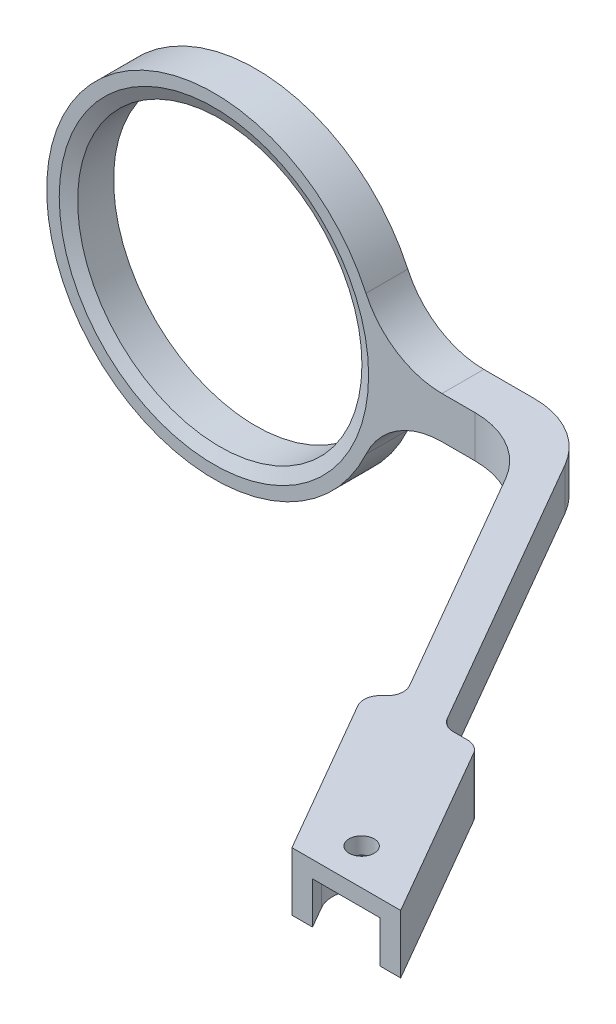
from build123d import *

# Parameters (mm, degrees)
BOSS_EXTRUDE1_DEPTH = 5
CHAMFER2_SIZE       = 1.5
CHAMFER2_SIZE2      = 0.699461487
FILLET1_R           = 10
BOSS_EXTRUDE2_DEPTH = 5
BOSS_EXTRUDE3_DEPTH = 7
CUT_EXTRUDE1_DEPTH  = 5
CUT_EXTRUDE2_DEPTH  = 1.5
SKETCH11_R          = 1.5
CUT_EXTRUDE3_DEPTH  = 102.79927269
FILLET2_R           = 10
FILLET3_R           = 2
FILLET4_R           = 2


with BuildPart() as part:
    # Sketch1 → Boss-Extrude1 (new body)
    with BuildSketch(Plane.XY):
        with BuildLine():
            ThreePointArc((16.815171721, -2.5), (-17, 0), (16.815171721, 2.5))
            Line((16.815171721, 2.5), (19.843134833, 2.5))
            ThreePointArc((19.843134833, 2.5), (-20, 0), (19.843134833, -2.5))
            Line((19.843134833, -2.5), (16.815171721, -2.5))
        make_face()
        with BuildLine():
            Line((19.843134833, 2.5), (16.815171721, 2.5))
            ThreePointArc((16.815171721, 2.5), (16.953729962, 1.253411494), (17, 0))
            ThreePointArc((17, 0), (16.953729962, -1.253411494), (16.815171721, -2.5))
            Line((16.815171721, -2.5), (19.843134833, -2.5))
            ThreePointArc((19.843134833, -2.5), (19.960745185, -1.252458251), (20, 0))
            ThreePointArc((20, 0), (19.960745185, 1.252458251), (19.843134833, 2.5))
        make_face()
        with BuildLine():
            Line((37, 2.5), (19.843134833, 2.5))
            ThreePointArc((19.843134833, 2.5), (19.960745185, 1.252458251), (20, 0))
            ThreePointArc((20, 0), (19.960745185, -1.252458251), (19.843134833, -2.5))
            Line((19.843134833, -2.5), (37, -2.5))
            Line((37, -2.5), (37, 2.5))
        make_face()
    extrude(amount=BOSS_EXTRUDE1_DEPTH)

    # Chamfer2
    chamfer2_edges = [part.edges().sort_by_distance(p)[0] for p in [
        (-16.815171721, -2.5, 5),
    ]]
    chamfer2_side = [part.faces().sort_by_distance(p)[0] for p in [
        (-17.503948469, -2.602404061, 5),
    ]]
    chamfer(chamfer2_edges, length=CHAMFER2_SIZE, length2=CHAMFER2_SIZE2, reference=chamfer2_side[0])

    # Fillet1
    fillet1_edges = [part.edges().sort_by_distance(p)[0] for p in [
        (19.843134833, 2.5, 2.5),
        (19.843134833, -2.5, 2.5),
    ]]
    fillet(fillet1_edges, radius=FILLET1_R)

    # Sketch3 → Boss-Extrude2 (add)
    with BuildSketch(Plane(origin=(0, 2.5, 0), x_dir=(1, 0, 0), z_dir=(0, 1, 0))):
        Polygon((39.113248654, 0), (74.331615075, -61), (69.331615075, -61), (37, -5), (37, 0), align=None)
    extrude(amount=-BOSS_EXTRUDE2_DEPTH)

    # Sketch5 → Boss-Extrude3 (add)
    with BuildSketch(Plane(origin=(0, 2.5, 0), x_dir=(1, 0, 0), z_dir=(0, 1, 0))):
        Polygon((65.331615075, -61), (78.331615075, -61), (65.831615075, -39.349364905), (52.831615075, -39.349364905), align=None)
    extrude(amount=-BOSS_EXTRUDE3_DEPTH)

    # Sketch9 → Cut-Extrude1 (cut)
    with BuildSketch(Plane.XZ.offset(4.5)):
        with BuildLine():
            Line((75.873066959, 61), (67.79016319, 61))
            Line((67.79016319, 61), (66.300526161, 58.419872981))
            ThreePointArc((66.300526161, 58.419872981), (67.581615075, 53.638784068), (72.362703988, 54.919872981))
            Line((72.362703988, 54.919872981), (75.873066959, 61))
        make_face()
    extrude(amount=-CUT_EXTRUDE1_DEPTH, mode=Mode.SUBTRACT)

    # Sketch10 → Cut-Extrude2 (cut)
    with BuildSketch(Plane.XZ.offset(-0.5)):
        Polygon((67.166551565, 57.919872981), (71.496678584, 55.419872981), (63.496678584, 41.563466521), (59.166551565, 44.063466521), align=None)
    extrude(amount=CUT_EXTRUDE2_DEPTH, mode=Mode.SUBTRACT)

    # Sketch11 → Cut-Extrude3 (cut, through all)
    with BuildSketch(Plane(origin=(0, 2.5, 0), x_dir=(1, 0, 0), z_dir=(0, 1, 0))):
        with Locations(Location((69.331615075, -56.669872981, 0), (0, 0, 180))):
            Circle(SKETCH11_R)
    extrude(amount=-CUT_EXTRUDE3_DEPTH, mode=Mode.SUBTRACT)

    # Fillet2
    fillet2_edges = [part.edges().sort_by_distance(p)[0] for p in [
        (37, 0, 5),
        (39.113248654, 0, 0),
    ]]
    fillet(fillet2_edges, radius=FILLET2_R)

    # Fillet3
    fillet3_edges = [part.edges().sort_by_distance(p)[0] for p in [
        (52.831615075, -1, 39.349364905),
        (65.831615075, -1, 39.349364905),
    ]]
    fillet(fillet3_edges, radius=FILLET3_R)

    # Fillet4
    # the kernel refuses this fillet: 2 mm, written as the material it adds along each edge
    with BuildSketch(Plane(origin=(61.831615075, 2.5, 39.349364905), x_dir=(1, 0, 0), z_dir=(0, -1, 0))) as fillet4_piece_1:
        with BuildLine():
            CenterArc((FILLET4_R * 0.57735026919, -FILLET4_R), FILLET4_R, 90, 60)
            Line((-FILLET4_R * 0.288675134595, -FILLET4_R * 0.5), (0, 0))
            Line((0, 0), (FILLET4_R * 0.57735026919, 0))
        make_face()
    extrude(amount=5)
    with BuildSketch(Plane(origin=(56.831615075, -2.5, 39.349364905), x_dir=(-0.9729624343176315, 0, 0.2309634200619407), z_dir=(0, 1, 0))) as fillet4_piece_2:
        with BuildLine():
            CenterArc((2.632289796, -1.822151945), FILLET4_R, 114.345531007, 82.300670054)
            Line((0.716106006, -2.395074001), (0.524487627, -2.452366207))
            Line((0.524487627, -2.452366207), (-0.191618379, -0.057292206))
            Line((-0.191618379, -0.057292206), (0.046192684, 0.194592487))
            ThreePointArc((0.046192684, 0.194592487), (0.567601681, 0.070819563), (1.725365119, 0.182215194))
            Line((1.725365119, 0.182215194), (1.807812817, 0))
        make_face()
    extrude(amount=5)


solid = part.part
